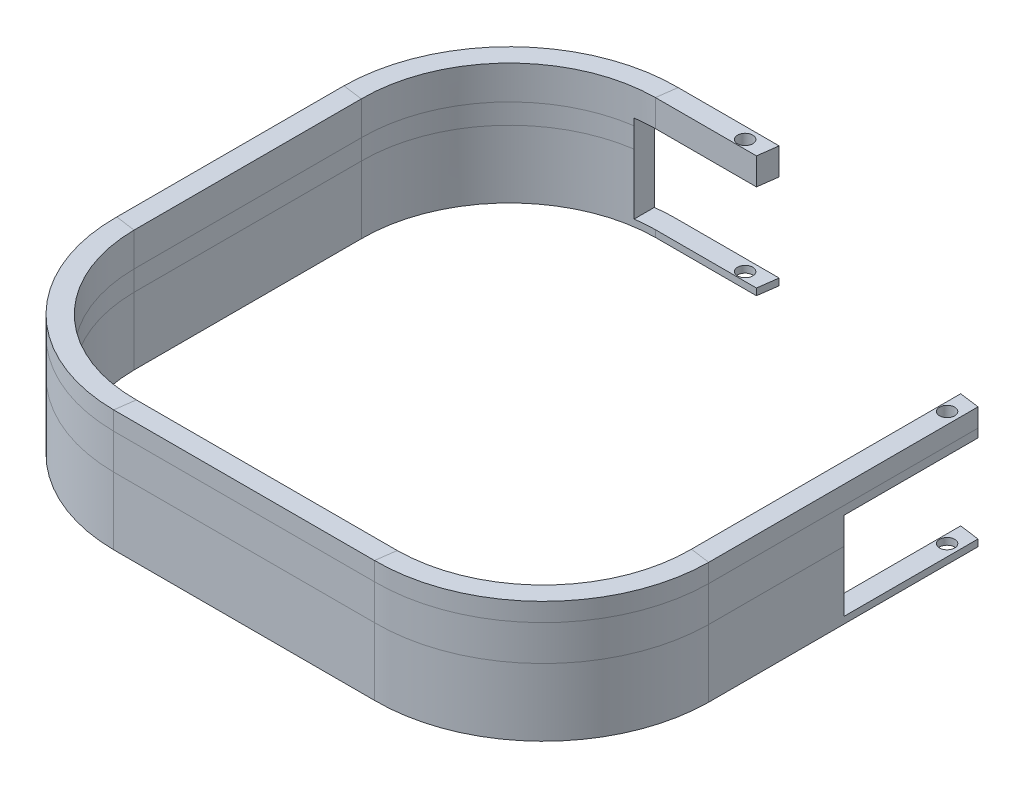
from build123d import *

# Parameters (mm, degrees)
M4_CLEARANCE_HOLE1_D   = 4.5
CUT_EXTRUDE1_START     = -24
CUT_EXTRUDE1_OUTLINE_R = 2.25
CUT_EXTRUDE1_DEPTH     = 26
SKETCH8_R              = 2.25
CUT_EXTRUDE2_DEPTH     = 26


# Read off the part's stored shape, not the designer's step: Cut-Extrude1
with BuildPart() as part:
    # Sweep1: sweep along a path in Sketch1
    with BuildLine(Plane(origin=(0, 152.68757152, 0), x_dir=(1, 0, 0), z_dir=(0, 1, 0))) as sweep1_path:
        Line((77.38365074, -11.079514347), (77.38365074, -91.079514347))
        ThreePointArc((77.38365074, -91.079514347), (63.83733937, -123.783202977), (31.13365074, -137.329514347))
        Line((31.13365074, -137.329514347), (-46.36634926, -137.329514347))
        ThreePointArc((-46.36634926, -137.329514347), (-79.07003789, -123.783202977), (-92.61634926, -91.079514347))
        Line((-92.61634926, -91.079514347), (-92.61634926, -23.579514347))
        ThreePointArc((-92.61634926, -23.579514347), (-79.07003789, 9.124174283), (-46.36634926, 22.670485653))
        Line((-46.36634926, 22.670485653), (-16.36634926, 22.670485653))
    # Sketch2 → Sweep1 (sweep)
    with BuildSketch(Plane.ZY.offset(52.61634926)):
        Polygon((-25.670485653, 153.211679549), (-25.670485653, 158.68757152), (-19.670485653, 158.68757152), (-19.670485653, 148.68757152), (-19.670485653, 142.68757152), (-19.670485653, 122.68757152), (-25.670485653, 122.68757152), (-25.670485653, 142.68757152), align=None)
    sweep(path=sweep1_path.line)

    # M4 Clearance Hole1 (through all)
    with Locations(Plane(origin=(0, 158.68757152, 0), x_dir=(1, 0, 0), z_dir=(0, 1, 0))):
        with Locations((-22.61634926, 22.670485653), (77.38365074, -17.329514347)):
            Hole(M4_CLEARANCE_HOLE1_D / 2)

    # Cut-Extrude1 outline → Cut-Extrude1 (cut)
    # profile 1 of 2: a face of its own
    with BuildSketch(Plane(origin=(0, 148.68757152, 0), x_dir=(1, 0, 0), z_dir=(0, 1, 0)).offset(CUT_EXTRUDE1_START)):
        Polygon((74.831520752, -51.329514347), (80.776483816, -51.329514347), (80.776483816, -11.542249894), (74.831520752, -10.731439084), align=None)
        with Locations((77.38365074, -17.329514347)):
            Circle(CUT_EXTRUDE1_OUTLINE_R, mode=Mode.SUBTRACT)
    # profile 2 of 2: a face of its own
    with BuildSketch(Plane(origin=(0, 148.68757152, 0), x_dir=(1, 0, 0), z_dir=(0, 1, 0)).offset(CUT_EXTRUDE1_START)):
        with BuildLine():
            ThreePointArc((-45.903613713, 26.063318729), (-49.266640093, 25.980684534), (-52.61634926, 25.670485653))
            Line((-52.61634926, 25.670485653), (-52.61634926, 19.670485653))
            ThreePointArc((-52.61634926, 19.670485653), (-49.672978387, 19.99445958), (-46.714424523, 20.118355665))
            Line((-46.714424523, 20.118355665), (-16.714424523, 20.118355665))
            Line((-16.714424523, 20.118355665), (-15.903613713, 26.063318729))
            Line((-15.903613713, 26.063318729), (-45.903613713, 26.063318729))
        make_face()
        with Locations((-42.61634926, 22.670485653)):
            Circle(CUT_EXTRUDE1_OUTLINE_R, mode=Mode.SUBTRACT)
        with Locations((-22.61634926, 22.670485653)):
            Circle(CUT_EXTRUDE1_OUTLINE_R, mode=Mode.SUBTRACT)
    extrude(amount=CUT_EXTRUDE1_DEPTH, mode=Mode.SUBTRACT)

    # Sketch8 → Cut-Extrude2 (cut)
    with BuildSketch(Plane(origin=(0, 124.68757152, 0), x_dir=(1, 0, 0), z_dir=(0, 1, 0))):
        with Locations(Location((-22.61634926, 22.670485653, 0), (0, 0, 270))):
            Circle(SKETCH8_R)
        with Locations((-42.61634926, 22.670485653)):
            Circle(SKETCH8_R)
    extrude(amount=CUT_EXTRUDE2_DEPTH, mode=Mode.SUBTRACT)


solid = part.part
